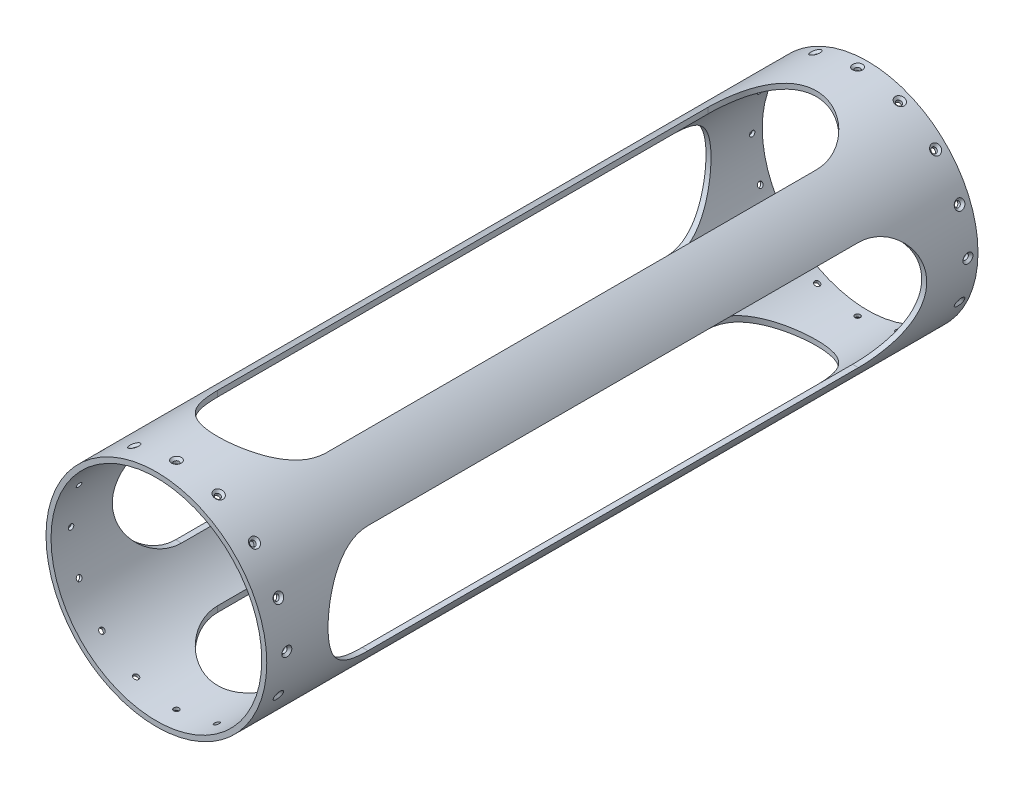
from build123d import *

# Parameters (mm, degrees)
SKETCH1_R                                       = 69.85
SKETCH1_R_2                                     = 66.675
EXTRUDE1_DEPTH                                  = 228.2063
CSK_FOR_M3_FLAT_HEAD_MACHINE_SCREW1_D           = 3.4
CSK_FOR_M3_FLAT_HEAD_MACHINE_SCREW1_CSINK_D     = 6.3
CSK_FOR_M3_FLAT_HEAD_MACHINE_SCREW1_CSINK_ANGLE = 90
EXTRUDE2_DEPTH                                  = 249.668776557
CIRPATTERN2_COUNT                               = 4
CIRPATTERN1_COUNT                               = 16
MIRROR1_COPY_1_DEPTH                            = 249.668776557
MIRROR1_COPY_2_DEPTH                            = 249.668776557
MIRROR1_COPY_3_DEPTH                            = 249.668776557
MIRROR1_COPY_4_D                                = 3.4
MIRROR1_COPY_4_CSINK_D                          = 6.3
MIRROR1_COPY_4_CSINK_ANGLE                      = 90
MIRROR1_COPY_5_D                                = 3.4
MIRROR1_COPY_5_CSINK_D                          = 6.3
MIRROR1_COPY_5_CSINK_ANGLE                      = 90
MIRROR1_COPY_6_D                                = 3.4
MIRROR1_COPY_6_CSINK_D                          = 6.3
MIRROR1_COPY_6_CSINK_ANGLE                      = 90
MIRROR1_COPY_7_D                                = 3.4
MIRROR1_COPY_7_CSINK_D                          = 6.3
MIRROR1_COPY_7_CSINK_ANGLE                      = 90
MIRROR1_COPY_8_D                                = 3.4
MIRROR1_COPY_8_CSINK_D                          = 6.3
MIRROR1_COPY_8_CSINK_ANGLE                      = 90
MIRROR1_COPY_9_D                                = 3.4
MIRROR1_COPY_9_CSINK_D                          = 6.3
MIRROR1_COPY_9_CSINK_ANGLE                      = 90
MIRROR1_COPY_10_D                               = 3.4
MIRROR1_COPY_10_CSINK_D                         = 6.3
MIRROR1_COPY_10_CSINK_ANGLE                     = 90
MIRROR1_COPY_11_D                               = 3.4
MIRROR1_COPY_11_CSINK_D                         = 6.3
MIRROR1_COPY_11_CSINK_ANGLE                     = 90
MIRROR1_COPY_12_D                               = 3.4
MIRROR1_COPY_12_CSINK_D                         = 6.3
MIRROR1_COPY_12_CSINK_ANGLE                     = 90
MIRROR1_COPY_13_D                               = 3.4
MIRROR1_COPY_13_CSINK_D                         = 6.3
MIRROR1_COPY_13_CSINK_ANGLE                     = 90
MIRROR1_COPY_14_D                               = 3.4
MIRROR1_COPY_14_CSINK_D                         = 6.3
MIRROR1_COPY_14_CSINK_ANGLE                     = 90
MIRROR1_COPY_15_D                               = 3.4
MIRROR1_COPY_15_CSINK_D                         = 6.3
MIRROR1_COPY_15_CSINK_ANGLE                     = 90
MIRROR1_COPY_16_D                               = 3.4
MIRROR1_COPY_16_CSINK_D                         = 6.3
MIRROR1_COPY_16_CSINK_ANGLE                     = 90
MIRROR1_COPY_17_D                               = 3.4
MIRROR1_COPY_17_CSINK_D                         = 6.3
MIRROR1_COPY_17_CSINK_ANGLE                     = 90
MIRROR1_COPY_18_D                               = 3.4
MIRROR1_COPY_18_CSINK_D                         = 6.3
MIRROR1_COPY_18_CSINK_ANGLE                     = 90
EXTRUDE3_START                                  = -6.35
SKETCH6_R                                       = 69.85
EXTRUDE3_DEPTH                                  = 6.35


with BuildPart() as part:
    # Sketch1 → Extrude1 (new body)
    with BuildSketch(Plane.XY):
        Circle(SKETCH1_R)
        Circle(SKETCH1_R_2, mode=Mode.SUBTRACT)
    extrude1 = extrude(amount=EXTRUDE1_DEPTH)

    # CSK for M3 Flat Head Machine Screw1 (through all)
    with Locations(Plane(origin=(0, -69.85, 215.5063), x_dir=(1, 0, 0), z_dir=(0, -1, 0))):
        with Locations((0, 0)):
            csk_for_m3_flat_head_machine_screw1 = CounterSinkHole(CSK_FOR_M3_FLAT_HEAD_MACHINE_SCREW1_D / 2, CSK_FOR_M3_FLAT_HEAD_MACHINE_SCREW1_CSINK_D / 2, counter_sink_angle=CSK_FOR_M3_FLAT_HEAD_MACHINE_SCREW1_CSINK_ANGLE)

    # Sketch5 → Extrude2 (cut, symmetric)
    with BuildSketch(Plane(origin=(0, 0, 0), x_dir=(1, 0, 0), z_dir=(0, 1, 0))):
        with BuildLine():
            Line((0, 0), (34.29, 0))
            Line((34.29, 0), (34.29, -155.139189337))
            ThreePointArc((34.29, -155.139189337), (0, -189.429189337), (-34.29, -155.139189337))
            Line((-34.29, -155.139189337), (-34.29, 0))
            Line((-34.29, 0), (0, 0))
        make_face()
    extrude2 = extrude(amount=EXTRUDE2_DEPTH, both=True, mode=Mode.SUBTRACT)

    # CirPattern2: Extrude2 ×4 about axis
    cirpattern2_axis = Axis((0, 0, 228.2063), (0, 0, -1))
    for i in range(1, CIRPATTERN2_COUNT):
        add(extrude2.rotate(cirpattern2_axis, i * 360 / CIRPATTERN2_COUNT), mode=Mode.SUBTRACT)

    # CirPattern1: CSK for M3 Flat Head Machine Screw1 ×16 about axis
    cirpattern1_axis = Axis((0, 0, 228.2063), (0, 0, -1))
    for i in range(1, CIRPATTERN1_COUNT):
        add(csk_for_m3_flat_head_machine_screw1.rotate(cirpattern1_axis, i * 360 / CIRPATTERN1_COUNT), mode=Mode.SUBTRACT)

    # Mirror1: Extrude1, CSK for M3 Flat Head Machine Screw1, Extrude2 across plane
    add(extrude1.mirror(Plane.XY))
    add(csk_for_m3_flat_head_machine_screw1.mirror(Plane.XY), mode=Mode.SUBTRACT)
    add(extrude2.mirror(Plane.XY), mode=Mode.SUBTRACT)

    # Mirror1 copy 1 sketch → Mirror1 copy 1 (cut, symmetric)
    with BuildSketch(Plane(origin=(0, 0, 0), x_dir=(0, -1, 0), z_dir=(1, 0, 0))):
        with BuildLine():
            Line((0, 0), (34.29, 0))
            Line((34.29, 0), (34.29, 155.139189337))
            ThreePointArc((34.29, 155.139189337), (0, 189.429189337), (-34.29, 155.139189337))
            Line((-34.29, 155.139189337), (-34.29, 0))
            Line((-34.29, 0), (0, 0))
        make_face()
    extrude(amount=MIRROR1_COPY_1_DEPTH, both=True, mode=Mode.SUBTRACT)

    # Mirror1 copy 2 sketch → Mirror1 copy 2 (cut, symmetric)
    with BuildSketch(Plane(origin=(0, 0, 0), x_dir=(-1, 0, 0), z_dir=(0, -1, 0))):
        with BuildLine():
            Line((0, 0), (34.29, 0))
            Line((34.29, 0), (34.29, 155.139189337))
            ThreePointArc((34.29, 155.139189337), (0, 189.429189337), (-34.29, 155.139189337))
            Line((-34.29, 155.139189337), (-34.29, 0))
            Line((-34.29, 0), (0, 0))
        make_face()
    extrude(amount=MIRROR1_COPY_2_DEPTH, both=True, mode=Mode.SUBTRACT)

    # Mirror1 copy 3 sketch → Mirror1 copy 3 (cut, symmetric)
    with BuildSketch(Plane(origin=(0, 0, 0), x_dir=(0, 1, 0), z_dir=(-1, 0, 0))):
        with BuildLine():
            Line((0, 0), (34.29, 0))
            Line((34.29, 0), (34.29, 155.139189337))
            ThreePointArc((34.29, 155.139189337), (0, 189.429189337), (-34.29, 155.139189337))
            Line((-34.29, 155.139189337), (-34.29, 0))
            Line((-34.29, 0), (0, 0))
        make_face()
    extrude(amount=MIRROR1_COPY_3_DEPTH, both=True, mode=Mode.SUBTRACT)

    # Mirror1 copy 4 (through all)
    with Locations(Plane(origin=(-26.730437751, -64.532985346, -215.5063), x_dir=(0.9238795325112868, -0.3826834323650896, 0), z_dir=(-0.3826834323650896, -0.9238795325112868, 0))):
        with Locations((0, 0)):
            CounterSinkHole(MIRROR1_COPY_4_D / 2, MIRROR1_COPY_4_CSINK_D / 2, counter_sink_angle=MIRROR1_COPY_4_CSINK_ANGLE)

    # Mirror1 copy 5 (through all)
    with Locations(Plane(origin=(-49.391408666, -49.391408666, -215.5063), x_dir=(0.7071067811865477, -0.7071067811865474, 0), z_dir=(-0.7071067811865474, -0.7071067811865477, 0))):
        with Locations((0, 0)):
            CounterSinkHole(MIRROR1_COPY_5_D / 2, MIRROR1_COPY_5_CSINK_D / 2, counter_sink_angle=MIRROR1_COPY_5_CSINK_ANGLE)

    # Mirror1 copy 6 (through all)
    with Locations(Plane(origin=(-64.532985346, -26.730437751, -215.5063), x_dir=(0.38268343236509, -0.9238795325112866, 0), z_dir=(-0.9238795325112866, -0.38268343236509, 0))):
        with Locations((0, 0)):
            CounterSinkHole(MIRROR1_COPY_6_D / 2, MIRROR1_COPY_6_CSINK_D / 2, counter_sink_angle=MIRROR1_COPY_6_CSINK_ANGLE)

    # Mirror1 copy 7 (through all)
    with Locations(Plane(origin=(-69.85, 0, -215.5063), x_dir=(0, -1, 0), z_dir=(-1, 0, 0))):
        with Locations((0, 0)):
            CounterSinkHole(MIRROR1_COPY_7_D / 2, MIRROR1_COPY_7_CSINK_D / 2, counter_sink_angle=MIRROR1_COPY_7_CSINK_ANGLE)

    # Mirror1 copy 8 (through all)
    with Locations(Plane(origin=(-64.532985346, 26.730437751, -215.5063), x_dir=(-0.38268343236508956, -0.9238795325112868, 0), z_dir=(-0.9238795325112868, 0.38268343236508956, 0))):
        with Locations((0, 0)):
            CounterSinkHole(MIRROR1_COPY_8_D / 2, MIRROR1_COPY_8_CSINK_D / 2, counter_sink_angle=MIRROR1_COPY_8_CSINK_ANGLE)

    # Mirror1 copy 9 (through all)
    with Locations(Plane(origin=(-49.391408666, 49.391408666, -215.5063), x_dir=(-0.7071067811865474, -0.7071067811865477, 0), z_dir=(-0.7071067811865477, 0.7071067811865474, 0))):
        with Locations((0, 0)):
            CounterSinkHole(MIRROR1_COPY_9_D / 2, MIRROR1_COPY_9_CSINK_D / 2, counter_sink_angle=MIRROR1_COPY_9_CSINK_ANGLE)

    # Mirror1 copy 10 (through all)
    with Locations(Plane(origin=(-26.730437751, 64.532985346, -215.5063), x_dir=(-0.9238795325112866, -0.38268343236509006, 0), z_dir=(-0.38268343236509006, 0.9238795325112866, 0))):
        with Locations((0, 0)):
            CounterSinkHole(MIRROR1_COPY_10_D / 2, MIRROR1_COPY_10_CSINK_D / 2, counter_sink_angle=MIRROR1_COPY_10_CSINK_ANGLE)

    # Mirror1 copy 11 (through all)
    with Locations(Plane(origin=(0, 69.85, -215.5063), x_dir=(-1, 0, 0), z_dir=(0, 1, 0))):
        with Locations((0, 0)):
            CounterSinkHole(MIRROR1_COPY_11_D / 2, MIRROR1_COPY_11_CSINK_D / 2, counter_sink_angle=MIRROR1_COPY_11_CSINK_ANGLE)

    # Mirror1 copy 12 (through all)
    with Locations(Plane(origin=(26.730437751, 64.532985346, -215.5063), x_dir=(-0.923879532511287, 0.3826834323650895, 0), z_dir=(0.3826834323650895, 0.923879532511287, 0))):
        with Locations((0, 0)):
            CounterSinkHole(MIRROR1_COPY_12_D / 2, MIRROR1_COPY_12_CSINK_D / 2, counter_sink_angle=MIRROR1_COPY_12_CSINK_ANGLE)

    # Mirror1 copy 13 (through all)
    with Locations(Plane(origin=(49.391408666, 49.391408666, -215.5063), x_dir=(-0.7071067811865478, 0.7071067811865474, 0), z_dir=(0.7071067811865474, 0.7071067811865478, 0))):
        with Locations((0, 0)):
            CounterSinkHole(MIRROR1_COPY_13_D / 2, MIRROR1_COPY_13_CSINK_D / 2, counter_sink_angle=MIRROR1_COPY_13_CSINK_ANGLE)

    # Mirror1 copy 14 (through all)
    with Locations(Plane(origin=(64.532985346, 26.730437751, -215.5063), x_dir=(-0.38268343236508967, 0.9238795325112867, 0), z_dir=(0.9238795325112867, 0.38268343236508967, 0))):
        with Locations((0, 0)):
            CounterSinkHole(MIRROR1_COPY_14_D / 2, MIRROR1_COPY_14_CSINK_D / 2, counter_sink_angle=MIRROR1_COPY_14_CSINK_ANGLE)

    # Mirror1 copy 15 (through all)
    with Locations(Plane(origin=(69.85, 0, -215.5063), x_dir=(0, 1, 0), z_dir=(1, 0, 0))):
        with Locations((0, 0)):
            CounterSinkHole(MIRROR1_COPY_15_D / 2, MIRROR1_COPY_15_CSINK_D / 2, counter_sink_angle=MIRROR1_COPY_15_CSINK_ANGLE)

    # Mirror1 copy 16 (through all)
    with Locations(Plane(origin=(64.532985346, -26.730437751, -215.5063), x_dir=(0.38268343236508984, 0.9238795325112867, 0), z_dir=(0.9238795325112867, -0.38268343236508984, 0))):
        with Locations((0, 0)):
            CounterSinkHole(MIRROR1_COPY_16_D / 2, MIRROR1_COPY_16_CSINK_D / 2, counter_sink_angle=MIRROR1_COPY_16_CSINK_ANGLE)

    # Mirror1 copy 17 (through all)
    with Locations(Plane(origin=(49.391408666, -49.391408666, -215.5063), x_dir=(0.7071067811865472, 0.7071067811865478, 0), z_dir=(0.7071067811865478, -0.7071067811865472, 0))):
        with Locations((0, 0)):
            CounterSinkHole(MIRROR1_COPY_17_D / 2, MIRROR1_COPY_17_CSINK_D / 2, counter_sink_angle=MIRROR1_COPY_17_CSINK_ANGLE)

    # Mirror1 copy 18 (through all)
    with Locations(Plane(origin=(26.730437751, -64.532985346, -215.5063), x_dir=(0.9238795325112867, 0.3826834323650897, 0), z_dir=(0.3826834323650897, -0.9238795325112867, 0))):
        with Locations((0, 0)):
            CounterSinkHole(MIRROR1_COPY_18_D / 2, MIRROR1_COPY_18_CSINK_D / 2, counter_sink_angle=MIRROR1_COPY_18_CSINK_ANGLE)

    # Sketch6 → Extrude3 (cut)
    with BuildSketch(Plane(origin=(0, 0, -228.2063), x_dir=(-1, 0, 0), z_dir=(0, 0, -1)).offset(EXTRUDE3_START)):
        Circle(SKETCH6_R)
    extrude(amount=EXTRUDE3_DEPTH, mode=Mode.SUBTRACT)


solid = part.part
